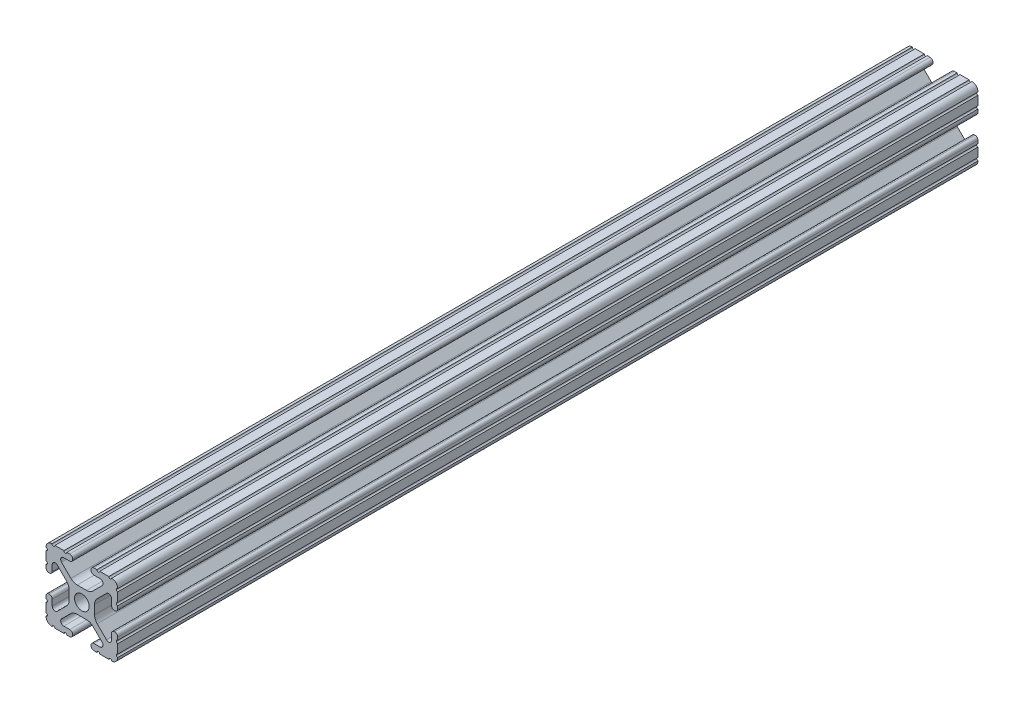
from build123d import *

# Parameters (mm, degrees)
SKETCH1_R           = 2.6035
BOSS_EXTRUDE1_DEPTH = 152.4


with BuildPart() as part:
    # Sketch1 → Boss-Extrude1 (new, symmetric)
    with BuildSketch(Plane.XY):
        with BuildLine():
            Line((-7.179650497, -8.645192506), (-3.952270251, -5.423690499))
            ThreePointArc((-3.952270251, -5.423690499), (-2.922936451, -4.736929036), (-1.709253557, -4.4958))
            Line((-1.709253557, -4.4958), (1.709253557, -4.4958))
            ThreePointArc((1.709253557, -4.4958), (2.922936451, -4.736929036), (3.952270251, -5.423690499))
            Line((3.952270251, -5.423690499), (7.179650497, -8.645192506))
            ThreePointArc((7.179650497, -8.645192506), (7.41473083, -9.822813117), (6.416408329, -10.4902))
            Line((6.416408329, -10.4902), (4.287512407, -10.4902))
            ThreePointArc((4.287512407, -10.4902), (3.54574862, -10.79744862), (3.2385, -11.539212407))
            Line((3.2385, -11.539212407), (3.2385, -11.650987593))
            ThreePointArc((3.2385, -11.650987593), (3.54574862, -12.39275138), (4.287512407, -12.7))
            Line((4.287512407, -12.7), (5.317126718, -12.7))
            ThreePointArc((5.317126718, -12.7), (5.825126718, -12.192), (6.333126718, -12.7))
            Line((6.333126718, -12.7), (9.550443118, -12.7))
            ThreePointArc((9.550443118, -12.7), (10.058366869, -12.192000006), (10.566443095, -12.699847501))
            ThreePointArc((10.566443095, -12.699847501), (12.082537762, -12.08250727), (12.699846982, -10.566399977))
            ThreePointArc((12.699846982, -10.566399977), (12.192000006, -10.058323491), (12.7, -9.5504))
            Line((12.7, -9.5504), (12.7, -6.3330836))
            ThreePointArc((12.7, -6.3330836), (12.192, -5.8250836), (12.7, -5.3170836))
            Line((12.7, -5.3170836), (12.7, -4.287469289))
            ThreePointArc((12.7, -4.287469289), (12.39275138, -3.545705502), (11.650987593, -3.238456882))
            Line((11.650987593, -3.238456882), (11.539212407, -3.238456882))
            ThreePointArc((11.539212407, -3.238456882), (10.79744862, -3.545705502), (10.4902, -4.287469289))
            Line((10.4902, -4.287469289), (10.4902, -6.402089023))
            ThreePointArc((10.4902, -6.402089023), (9.856505071, -7.351067942), (8.737131347, -7.129408934))
            Line((8.737131347, -7.129408934), (5.441005833, -3.840816462))
            ThreePointArc((5.441005833, -3.840816462), (4.750877967, -2.809883091), (4.5085, -1.593185507))
            Line((4.5085, -1.593185507), (4.5085, 1.593185507))
            ThreePointArc((4.5085, 1.593185507), (4.750877967, 2.809883091), (5.441005833, 3.840816462))
            Line((5.441005833, 3.840816462), (8.737131347, 7.129408934))
            ThreePointArc((8.737131347, 7.129408934), (9.856505071, 7.351067942), (10.4902, 6.402089023))
            Line((10.4902, 6.402089023), (10.4902, 4.287469289))
            ThreePointArc((10.4902, 4.287469289), (10.79744862, 3.545705502), (11.539212407, 3.238456882))
            Line((11.539212407, 3.238456882), (11.650987593, 3.238456882))
            ThreePointArc((11.650987593, 3.238456882), (12.39275138, 3.545705502), (12.7, 4.287469289))
            Line((12.7, 4.287469289), (12.7, 5.3170836))
            ThreePointArc((12.7, 5.3170836), (12.192, 5.8250836), (12.7, 6.3330836))
            Line((12.7, 6.3330836), (12.7, 9.5504))
            ThreePointArc((12.7, 9.5504), (12.192000006, 10.058323491), (12.699846982, 10.566399977))
            ThreePointArc((12.699846982, 10.566399977), (12.082537762, 12.08250727), (10.566443095, 12.699847501))
            ThreePointArc((10.566443095, 12.699847501), (10.058366869, 12.192000006), (9.550443118, 12.7))
            Line((9.550443118, 12.7), (6.333126718, 12.7))
            ThreePointArc((6.333126718, 12.7), (5.825126718, 12.192), (5.317126718, 12.7))
            Line((5.317126718, 12.7), (4.287512407, 12.7))
            ThreePointArc((4.287512407, 12.7), (3.54574862, 12.39275138), (3.2385, 11.650987593))
            Line((3.2385, 11.650987593), (3.2385, 11.539212407))
            ThreePointArc((3.2385, 11.539212407), (3.54574862, 10.79744862), (4.287512407, 10.4902))
            Line((4.287512407, 10.4902), (6.476788598, 10.4902))
            ThreePointArc((6.476788598, 10.4902), (7.432222385, 9.85140422), (7.207036008, 8.724370562))
            Line((7.207036008, 8.724370562), (3.898272566, 5.423169045))
            ThreePointArc((3.898272566, 5.423169045), (2.869120213, 4.736787962), (1.655778399, 4.4958))
            Line((1.655778399, 4.4958), (-1.655778399, 4.4958))
            ThreePointArc((-1.655778399, 4.4958), (-2.869120213, 4.736787962), (-3.898272566, 5.423169045))
            Line((-3.898272566, 5.423169045), (-7.207036008, 8.724370562))
            ThreePointArc((-7.207036008, 8.724370562), (-7.432222385, 9.85140422), (-6.476788598, 10.4902))
            Line((-6.476788598, 10.4902), (-4.287512407, 10.4902))
            ThreePointArc((-4.287512407, 10.4902), (-3.54574862, 10.79744862), (-3.2385, 11.539212407))
            Line((-3.2385, 11.539212407), (-3.2385, 11.650987593))
            ThreePointArc((-3.2385, 11.650987593), (-3.54574862, 12.39275138), (-4.287512407, 12.7))
            Line((-4.287512407, 12.7), (-5.317126718, 12.7))
            ThreePointArc((-5.317126718, 12.7), (-5.825126718, 12.192), (-6.333126718, 12.7))
            Line((-6.333126718, 12.7), (-9.550443118, 12.7))
            ThreePointArc((-9.550443118, 12.7), (-10.058366869, 12.192000006), (-10.566443095, 12.699847501))
            ThreePointArc((-10.566443095, 12.699847501), (-12.082537762, 12.08250727), (-12.699846982, 10.566399977))
            ThreePointArc((-12.699846982, 10.566399977), (-12.192000006, 10.058323491), (-12.7, 9.5504))
            Line((-12.7, 9.5504), (-12.7, 6.3330836))
            ThreePointArc((-12.7, 6.3330836), (-12.192, 5.8250836), (-12.7, 5.3170836))
            Line((-12.7, 5.3170836), (-12.7, 4.287469289))
            ThreePointArc((-12.7, 4.287469289), (-12.39275138, 3.545705502), (-11.650987593, 3.238456882))
            Line((-11.650987593, 3.238456882), (-11.539212407, 3.238456882))
            ThreePointArc((-11.539212407, 3.238456882), (-10.79744862, 3.545705502), (-10.4902, 4.287469289))
            Line((-10.4902, 4.287469289), (-10.4902, 6.402089023))
            ThreePointArc((-10.4902, 6.402089023), (-9.856505071, 7.351067942), (-8.737131347, 7.129408934))
            Line((-8.737131347, 7.129408934), (-5.441005833, 3.840816462))
            ThreePointArc((-5.441005833, 3.840816462), (-4.750877967, 2.809883091), (-4.5085, 1.593185507))
            Line((-4.5085, 1.593185507), (-4.5085, -1.593185507))
            ThreePointArc((-4.5085, -1.593185507), (-4.750877967, -2.809883091), (-5.441005833, -3.840816462))
            Line((-5.441005833, -3.840816462), (-8.737131347, -7.129408934))
            ThreePointArc((-8.737131347, -7.129408934), (-9.856505071, -7.351067942), (-10.4902, -6.402089023))
            Line((-10.4902, -6.402089023), (-10.4902, -4.287469289))
            ThreePointArc((-10.4902, -4.287469289), (-10.79744862, -3.545705502), (-11.539212407, -3.238456882))
            Line((-11.539212407, -3.238456882), (-11.650987593, -3.238456882))
            ThreePointArc((-11.650987593, -3.238456882), (-12.39275138, -3.545705502), (-12.7, -4.287469289))
            Line((-12.7, -4.287469289), (-12.7, -5.3170836))
            ThreePointArc((-12.7, -5.3170836), (-12.192, -5.8250836), (-12.7, -6.3330836))
            Line((-12.7, -6.3330836), (-12.7, -9.5504))
            ThreePointArc((-12.7, -9.5504), (-12.192000006, -10.058323491), (-12.699846982, -10.566399977))
            ThreePointArc((-12.699846982, -10.566399977), (-12.082537762, -12.08250727), (-10.566443095, -12.699847501))
            ThreePointArc((-10.566443095, -12.699847501), (-10.058366869, -12.192000006), (-9.550443118, -12.7))
            Line((-9.550443118, -12.7), (-6.333126718, -12.7))
            ThreePointArc((-6.333126718, -12.7), (-5.825126718, -12.192), (-5.317126718, -12.7))
            Line((-5.317126718, -12.7), (-4.287512407, -12.7))
            ThreePointArc((-4.287512407, -12.7), (-3.54574862, -12.39275138), (-3.2385, -11.650987593))
            Line((-3.2385, -11.650987593), (-3.2385, -11.539212407))
            ThreePointArc((-3.2385, -11.539212407), (-3.54574862, -10.79744862), (-4.287512407, -10.4902))
            Line((-4.287512407, -10.4902), (-6.416408329, -10.4902))
            ThreePointArc((-6.416408329, -10.4902), (-7.41473083, -9.822813117), (-7.179650497, -8.645192506))
        make_face()
        Circle(SKETCH1_R, mode=Mode.SUBTRACT)
    extrude(amount=BOSS_EXTRUDE1_DEPTH, both=True)


solid = part.part
